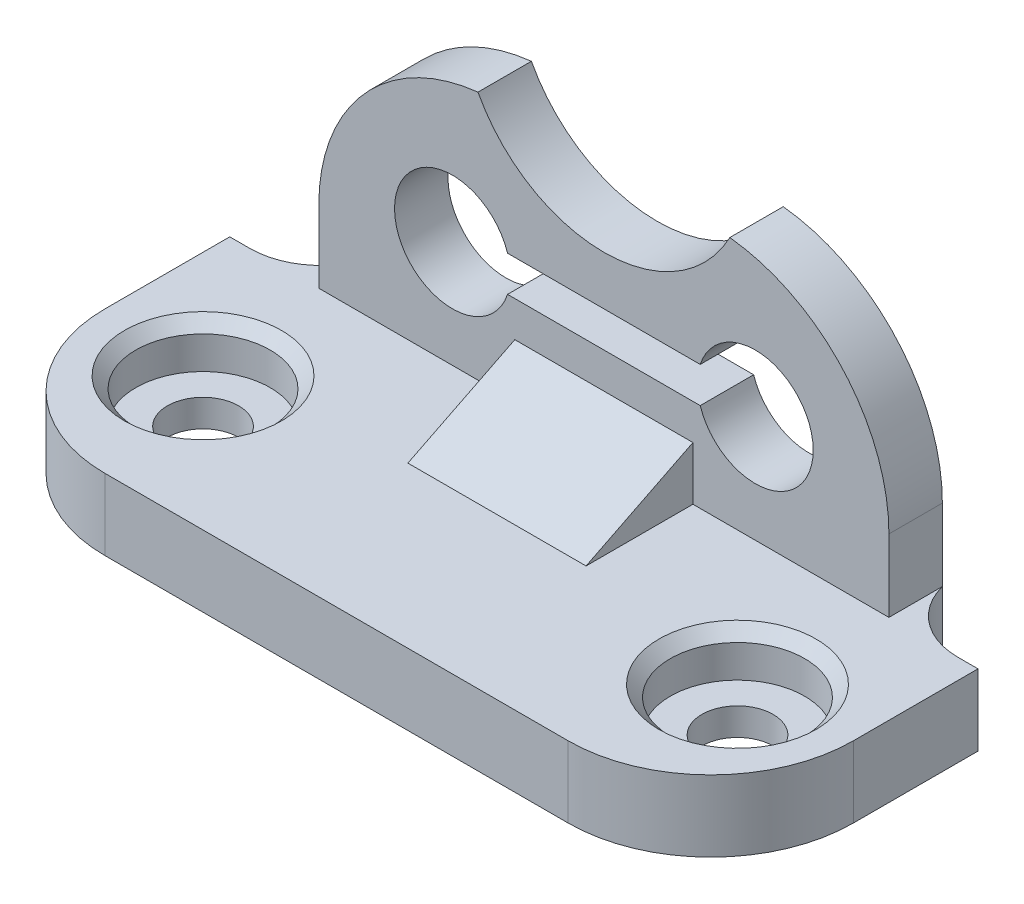
from build123d import *

# Parameters (mm, degrees)
CROQUIS1_W                                  = 16.000027591
CROQUIS1_H                                  = 18
CROQUIS1_R                                  = 3.25
SALIENTE_EXTRUIR1_DEPTH                     = 3
CROQUIS2_W                                  = 15
CROQUIS2_H                                  = 2
CORTAR_EXTRUIR1_DEPTH                       = 3
REDONDEO1_R                                 = 10
CROQUIS3_W                                  = 15
CROQUIS3_H                                  = 4
SALIENTE_EXTRUIR2_DEPTH                     = 21
CROQUIS4_R                                  = 2
CORTAR_EXTRUIR2_DEPTH                       = 32
REDONDEO2_R                                 = 8
REFRENTADO_PARA_TORNILLO_CON_CABEZA_2_COUNT = 2
REFRENTADO_PARA_TORNILLO_CON_CABEZA_2_PITCH = 30
NERVIO1_REACH                               = 31.086
CROQUIS6_WALL_W                             = 66.880362222
CROQUIS6_WALL_H                             = 10
REDONDEO3_R                                 = 4


with BuildPart() as part:
    # Croquis1 → Saliente-Extruir1 (new body)
    # profile 1 of 2: a face of its own
    with BuildSketch(Plane.XY):
        with Locations((-8.000013796, 0)):
            Rectangle(CROQUIS1_W, CROQUIS1_H)
        with Locations((-8.5, 1)):
            Circle(CROQUIS1_R, mode=Mode.SUBTRACT)
    # profile 2 of 2: a face of its own
    with BuildSketch(Plane.XY):
        with Locations((8.000013796, 0)):
            Rectangle(CROQUIS1_W, CROQUIS1_H)
        with Locations((8.5, 1)):
            Circle(CROQUIS1_R, mode=Mode.SUBTRACT)
    extrude(amount=SALIENTE_EXTRUIR1_DEPTH)

    # Croquis2 → Cortar-Extruir1 (cut)
    with BuildSketch(Plane.XY.offset(3)):
        with BuildLine():
            ThreePointArc((7.068057866, 9), (7.76351927, 10.816597123), (8, 12.747340124))
            ThreePointArc((8, 12.747340124), (-1.930743001, 20.510859395), (-7.068057866, 9))
            Line((-7.068057866, 9), (7.068057866, 9))
        make_face()
        with BuildLine():
            Line((7.068057866, 9), (-7.068057866, 9))
            ThreePointArc((-7.068057866, 9), (0, 4.747340124), (7.068057866, 9))
        make_face()
        with Locations((0, 1)):
            Rectangle(CROQUIS2_W, CROQUIS2_H)
    extrude(amount=-CORTAR_EXTRUIR1_DEPTH, mode=Mode.SUBTRACT)

    # Redondeo1
    # the kernel refuses this fillet: 10 mm, written as the material it takes off along each edge
    with BuildSketch(Plane(origin=(16.000027591, 9, -24.857004965), x_dir=(-1, 0, 0), z_dir=(0, 0, 1))) as redondeo1_piece_1:
        with BuildLine():
            CenterArc((10, 9.942801986), REDONDEO1_R, 180, 83.86894335)
            Line((0, 9.942801986), (-0.2, 9.942801986))
            Line((-0.2, 9.942801986), (-0.2, 0))
            Line((-0.2, 0), (0, -0.2))
            ThreePointArc((0, -0.2), (4.465984863, -0.2), (8.91060912, -0.19885604))
            Line((8.91060912, -0.19885604), (8.931969726, 0))
        make_face()
    extrude(amount=52.71400993, mode=Mode.SUBTRACT)
    with BuildSketch(Plane(origin=(-16.000027591, 9, -24.857004965), x_dir=(1, 0, 0), z_dir=(0, 0, 1))) as redondeo1_piece_2:
        with BuildLine():
            CenterArc((10, -9.942801986), REDONDEO1_R, 96.13105665, 83.86894335)
            Line((0, -9.942801986), (-0.2, -9.942801986))
            Line((-0.2, -9.942801986), (-0.2, 0))
            Line((-0.2, 0), (0, 0.2))
            ThreePointArc((0, 0.2), (4.465984863, 0.2), (8.91060912, 0.19885604))
            Line((8.91060912, 0.19885604), (8.931969726, 0))
        make_face()
    extrude(amount=52.71400993, mode=Mode.SUBTRACT)

    # Croquis3 → Saliente-Extruir2 (add, symmetric)
    with BuildSketch(Plane(origin=(0, 0, 0), x_dir=(0, 0, -1), z_dir=(1, 0, 0))):
        with Locations((-10.5, -7)):
            Rectangle(CROQUIS3_W, CROQUIS3_H)
    extrude(amount=SALIENTE_EXTRUIR2_DEPTH, both=True)

    # Croquis4 → Cortar-Extruir2 (cut)
    with BuildSketch(Plane(origin=(0, -5, 0), x_dir=(1, 0, 0), z_dir=(0, 1, 0))):
        with Locations(Location((-15, -10.5, 0), (0, 0, 270))):
            Circle(CROQUIS4_R)
        with Locations(Location((15, -10.5, 0), (0, 0, 90))):
            Circle(CROQUIS4_R)
    extrude(amount=-CORTAR_EXTRUIR2_DEPTH, mode=Mode.SUBTRACT)

    # Redondeo2
    redondeo2_edges = [part.edges().sort_by_distance(p)[0] for p in [
        (-21, -7, 18),
        (21, -7, 18),
    ]]
    fillet(redondeo2_edges, radius=REDONDEO2_R)

    # Croquis5 → Refrentado para tornillo con cabeza troncocónica de #61 (revolve, cut)
    with BuildSketch(Plane(origin=(-15, -5, 10.5), x_dir=(0, 0, 1), z_dir=(1, 0, 0))):
        Polygon((0, 0), (0, 4), (1.89865, 4), (1.89865, 2.4638), (3.77063, 2.4638), (3.77063, 0.635), (4.40563, 0), align=None)
    refrentado_para_tornillo_con_cabeza_tron = revolve(axis=Axis((-15, 1.35, 10.5), (0, -1, 0)), mode=Mode.SUBTRACT)

    # Refrentado para tornillo con cabeza  2: Refrentado para tornillo con cabeza troncocónica de #61 ×2
    with Locations(*[(i * REFRENTADO_PARA_TORNILLO_CON_CABEZA_2_PITCH, 0, 0) for i in range(1, REFRENTADO_PARA_TORNILLO_CON_CABEZA_2_COUNT)]):
        add(refrentado_para_tornillo_con_cabeza_tron, mode=Mode.SUBTRACT)

    # Croquis6 wall → Nervio1 (add, up to next)
    with BuildSketch(Plane(origin=(0, -3.5, 6), x_dir=(0, -0.4472135955, 0.894427191), z_dir=(0, -0.894427191, -0.4472135955)), mode=Mode.PRIVATE) as nervio1_sk1:
        Rectangle(CROQUIS6_WALL_W, CROQUIS6_WALL_H)
    nervio1_tool1 = extrude(nervio1_sk1.sketch, amount=NERVIO1_REACH, mode=Mode.PRIVATE) - part.part
    add(nervio1_tool1.solids().sort_by_distance((0, -3.5, 6))[0])

    # Redondeo3
    # the kernel refuses this fillet: 4 mm, written as the material it adds along each edge
    with BuildSketch(Plane(origin=(16.000027591, -9, 3), x_dir=(0, 0, -1), z_dir=(0, 1, 0))) as redondeo3_piece_1:
        with BuildLine():
            CenterArc((4, -3.872983346), REDONDEO3_R, 104.477512186, 75.522487814)
            Line((0, -3.872983346), (0, 0))
            Line((0, 0), (3, 0))
        make_face()
    extrude(amount=4)
    with BuildSketch(Plane(origin=(-16.000027591, -9, 3), x_dir=(-1, 0, 0), z_dir=(0, 1, 0))) as redondeo3_piece_2:
        with BuildLine():
            CenterArc((3.872983346, -4), REDONDEO3_R, 90, 75.522487814)
            Line((0, -3), (0, 0))
            Line((0, 0), (3.872983346, 0))
        make_face()
    extrude(amount=4)


solid = part.part
